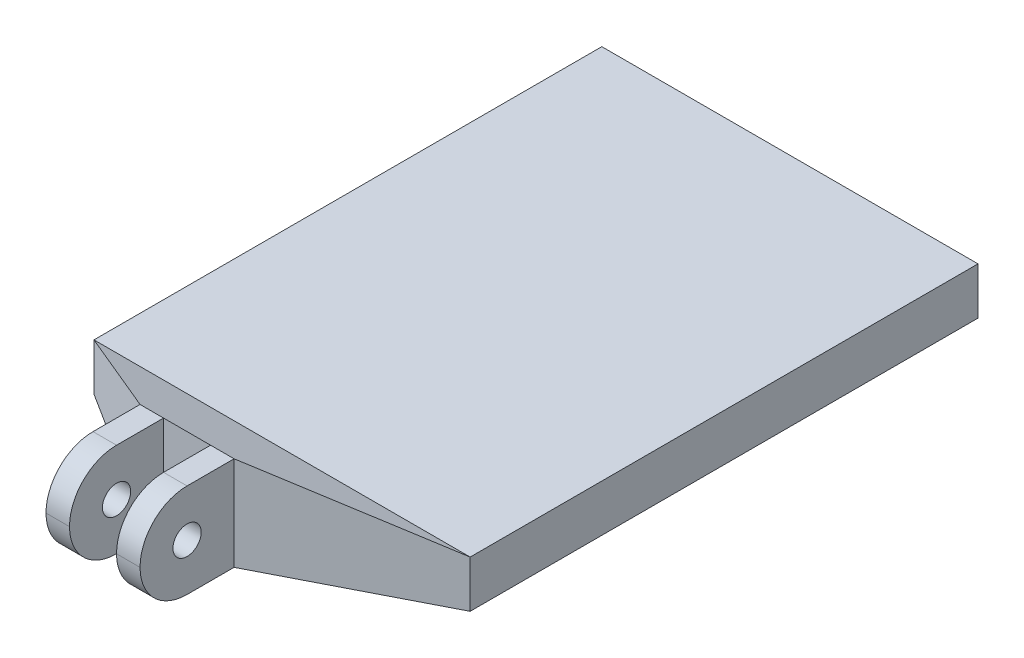
from build123d import *

# Parameters (mm, degrees)
SKETCH1_W           = 20
SKETCH1_H           = 2.5
BOSS_EXTRUDE1_DEPTH = 28
SKETCH7_W           = 1.25
SKETCH7_H           = 5
BOSS_EXTRUDE3_DEPTH = 5
FILLET1_R           = 2.5
SKETCH8_R           = 0.75
CUT_EXTRUDE3_DEPTH  = 38.569302663
CHAMFER1_SIZE       = 1


with BuildPart() as part:
    # Sketch1 → Boss-Extrude1 (new body)
    with BuildSketch(Plane.XY):
        Rectangle(SKETCH1_W, SKETCH1_H)
    extrude(amount=BOSS_EXTRUDE1_DEPTH)

    # Sketch3 → section 0 of loft1
    with BuildSketch(Plane.XY.offset(31), mode=Mode.PRIVATE) as loft1_s0:
        with BuildLine():
            Line((-4.55, 2.5), (0.45, 2.5))
            Line((0.45, 2.5), (0.45, -2.5))
            Line((0.45, -2.5), (-4.55, -2.5))
            Line((-4.55, -2.5), (-4.55, 2.5))
        make_face()
    # loft up to a face of the part (loft1)
    loft([loft1_s0.sketch, part.faces().sort_by_distance((0, 0, 28))[0]])

    # Sketch7 → Boss-Extrude3 (add)
    with BuildSketch(Plane.XY.offset(31)):
        with Locations((-3.925, 0)):
            Rectangle(SKETCH7_W, SKETCH7_H)
        with Locations((-0.175, 0)):
            Rectangle(SKETCH7_W, SKETCH7_H)
    extrude(amount=BOSS_EXTRUDE3_DEPTH)

    # Fillet1
    fillet1_edges = [part.edges().sort_by_distance(p)[0] for p in [
        (-0.175, -2.5, 36),
        (-3.925, -2.5, 36),
        (-3.925, 2.5, 36),
        (-0.175, 2.5, 36),
    ]]
    fillet(fillet1_edges, radius=FILLET1_R - 0.0001)  # a hair under: the kernel refuses the full size

    # Sketch8 → Cut-Extrude3 (cut, through all)
    with BuildSketch(Plane(origin=(0.45, 0, 0), x_dir=(0, 0, -1), z_dir=(1, 0, 0))):
        with Locations((-33.5, 0)):
            Circle(SKETCH8_R)
    extrude(amount=-CUT_EXTRUDE3_DEPTH, mode=Mode.SUBTRACT)

    # Chamfer1
    chamfer1_edges = [part.edges().sort_by_distance(p)[0] for p in [
        (0, -1.25, 0),
        (-10, 0, 0),
        (0, 1.25, 0),
        (10, 0, 0),
    ]]
    chamfer(chamfer1_edges, length=CHAMFER1_SIZE)


solid = part.part
